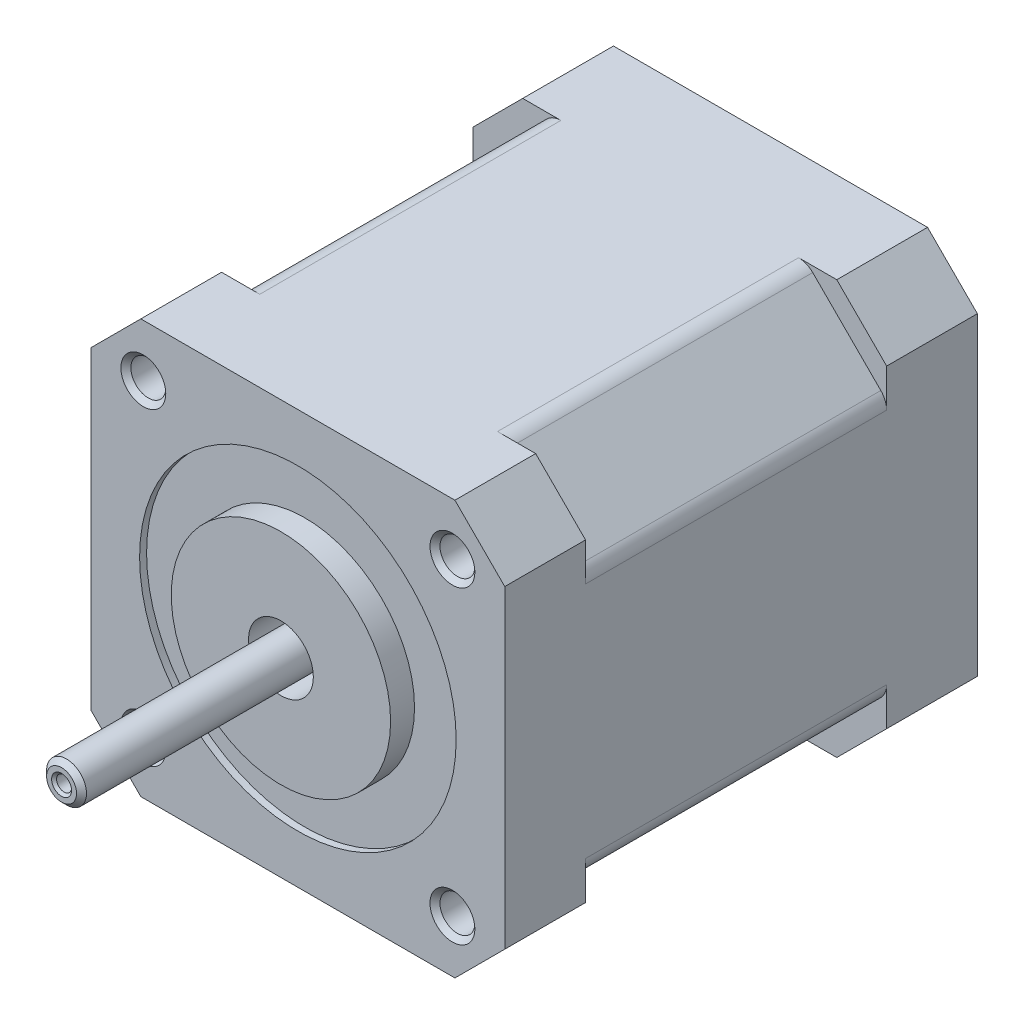
from build123d import *

# Parameters (mm, degrees)
BOSS_EXTRUDE1_DEPTH = 9.1
BOSS_EXTRUDE2_DEPTH = 30.2
BOSS_EXTRUDE3_DEPTH = 8.1
SKETCH4_R           = 15.875
CUT_EXTRUDE1_DEPTH  = 0.7
SKETCH5_R           = 11
BOSS_EXTRUDE4_DEPTH = 2.4
SKETCH6_R           = 1.75
CUT_EXTRUDE2_DEPTH  = 58.200830414
CHAMFER1_SIZE       = 0.5
SKETCH7_R           = 3.95
CUT_EXTRUDE3_DEPTH  = 3.3
SKETCH8_R           = 3.25
CUT_EXTRUDE4_DEPTH  = 5
SKETCH9_R           = 2
BOSS_EXTRUDE5_DEPTH = 27
CHAMFER2_SIZE       = 0.5
SKETCH10_R          = 0.75
CUT_EXTRUDE5_DEPTH  = 3
CHAMFER3_SIZE       = 0.25
SKETCH11_R          = 2.5
BOSS_EXTRUDE6_DEPTH = 0.5
CHAMFER4_SIZE       = 0.5
CUT_EXTRUDE6_START  = -3
SKETCH12_R          = 0.75
CUT_EXTRUDE6_DEPTH  = 3
CHAMFER5_SIZE       = 0.25
SKETCH14_W          = 8
SKETCH14_H          = 7.1
CUT_EXTRUDE8_DEPTH  = 5


with BuildPart() as part:
    # Sketch1 → Boss-Extrude1 (new body)
    with BuildSketch(Plane.XY):
        Polygon((15.75, 20.75), (20.75, 15.75), (20.75, -15.75), (15.75, -20.75), (-15.75, -20.75), (-20.75, -15.75), (-20.75, 15.75), (-15.75, 20.75), align=None)
    extrude(amount=BOSS_EXTRUDE1_DEPTH)

    # Sketch2 → Boss-Extrude2 (add)
    with BuildSketch(Plane.XY.offset(9.1)):
        with BuildLine():
            Line((13.335786438, 20.164213562), (20.164213562, 13.335786438))
            ThreePointArc((20.164213562, 13.335786438), (20.597759065, 12.68693974), (20.75, 11.921572875))
            Line((20.75, 11.921572875), (20.75, -11.921572875))
            ThreePointArc((20.75, -11.921572875), (20.597759065, -12.68693974), (20.164213562, -13.335786438))
            Line((20.164213562, -13.335786438), (13.335786438, -20.164213562))
            ThreePointArc((13.335786438, -20.164213562), (12.68693974, -20.597759065), (11.921572875, -20.75))
            Line((11.921572875, -20.75), (-11.921572875, -20.75))
            ThreePointArc((-11.921572875, -20.75), (-12.68693974, -20.597759065), (-13.335786438, -20.164213562))
            Line((-13.335786438, -20.164213562), (-20.164213562, -13.335786438))
            ThreePointArc((-20.164213562, -13.335786438), (-20.597759065, -12.68693974), (-20.75, -11.921572875))
            Line((-20.75, -11.921572875), (-20.75, 11.921572875))
            ThreePointArc((-20.75, 11.921572875), (-20.597759065, 12.68693974), (-20.164213562, 13.335786438))
            Line((-20.164213562, 13.335786438), (-13.335786438, 20.164213562))
            ThreePointArc((-13.335786438, 20.164213562), (-12.68693974, 20.597759065), (-11.921572875, 20.75))
            Line((-11.921572875, 20.75), (11.921572875, 20.75))
            ThreePointArc((11.921572875, 20.75), (12.68693974, 20.597759065), (13.335786438, 20.164213562))
        make_face()
    extrude(amount=BOSS_EXTRUDE2_DEPTH)

    # Sketch3 → Boss-Extrude3 (add)
    with BuildSketch(Plane.XY.offset(39.3)):
        Polygon((15.75, 20.75), (20.75, 15.75), (20.75, -15.75), (15.75, -20.75), (-15.75, -20.75), (-20.75, -15.75), (-20.75, 15.75), (-15.75, 20.75), align=None)
    extrude(amount=BOSS_EXTRUDE3_DEPTH)

    # Sketch4 → Cut-Extrude1 (cut)
    with BuildSketch(Plane.XY.offset(47.4)):
        Circle(SKETCH4_R)
    extrude(amount=-CUT_EXTRUDE1_DEPTH, mode=Mode.SUBTRACT)

    # Sketch5 → Boss-Extrude4 (add)
    with BuildSketch(Plane.XY.offset(46.7)):
        Circle(SKETCH5_R)
    extrude(amount=BOSS_EXTRUDE4_DEPTH)

    # Sketch6 → Cut-Extrude2 (cut, through all)
    with BuildSketch(Plane(origin=(0, 0, 0), x_dir=(-1, 0, 0), z_dir=(0, 0, -1))):
        with Locations((-15.5, 15.5)):
            Circle(SKETCH6_R)
        with Locations((-15.5, -15.5)):
            Circle(SKETCH6_R)
        with Locations((15.5, -15.5)):
            Circle(SKETCH6_R)
        with Locations((15.5, 15.5)):
            Circle(SKETCH6_R)
    extrude(amount=-CUT_EXTRUDE2_DEPTH, mode=Mode.SUBTRACT)

    # Chamfer1
    chamfer1_edges = [part.edges().sort_by_distance(p)[0] for p in [
        (17.25, 15.5, 47.4),
        (17.25, 15.5, 0),
        (17.25, -15.5, 47.4),
        (17.25, -15.5, 0),
        (-13.75, -15.5, 47.4),
        (-13.75, -15.5, 0),
        (-13.75, 15.5, 47.4),
        (-13.75, 15.5, 0),
    ]]
    chamfer(chamfer1_edges, length=CHAMFER1_SIZE)

    # Sketch7 → Cut-Extrude3 (cut)
    with BuildSketch(Plane(origin=(0, 0, 0), x_dir=(-1, 0, 0), z_dir=(0, 0, -1))):
        Circle(SKETCH7_R)
    extrude(amount=-CUT_EXTRUDE3_DEPTH, mode=Mode.SUBTRACT)

    # Sketch8 → Cut-Extrude4 (cut)
    with BuildSketch(Plane.XY.offset(49.1)):
        Circle(SKETCH8_R)
    extrude(amount=-CUT_EXTRUDE4_DEPTH, mode=Mode.SUBTRACT)

    # Sketch9 → Boss-Extrude5 (add)
    with BuildSketch(Plane.XY.offset(44.1)):
        Circle(SKETCH9_R)
    extrude(amount=BOSS_EXTRUDE5_DEPTH)

    # Chamfer2
    chamfer2_edges = [part.edges().sort_by_distance(p)[0] for p in [
        (-2, 0, 71.1),
    ]]
    chamfer(chamfer2_edges, length=CHAMFER2_SIZE)

    # Sketch10 → Cut-Extrude5 (cut)
    with BuildSketch(Plane.XY.offset(71.1)):
        Circle(SKETCH10_R)
    extrude(amount=-CUT_EXTRUDE5_DEPTH, mode=Mode.SUBTRACT)

    # Chamfer3
    chamfer3_edges = [part.edges().sort_by_distance(p)[0] for p in [
        (-0.75, 0, 71.1),
    ]]
    chamfer(chamfer3_edges, length=CHAMFER3_SIZE)

    # Sketch11 → Boss-Extrude6 (add)
    with BuildSketch(Plane(origin=(0, 0, 3.3), x_dir=(-1, 0, 0), z_dir=(0, 0, -1))):
        Circle(SKETCH11_R)
    extrude(amount=BOSS_EXTRUDE6_DEPTH)

    # Chamfer4
    chamfer4_edges = [part.edges().sort_by_distance(p)[0] for p in [
        (2.5, 0, 2.8),
    ]]
    chamfer(chamfer4_edges, length=CHAMFER4_SIZE - 0.0001)  # a hair under: the kernel refuses the full size

    # Sketch12 → Cut-Extrude6 (cut)
    with BuildSketch(Plane(origin=(0, 0, 2.8), x_dir=(-1, 0, 0), z_dir=(0, 0, -1)).offset(CUT_EXTRUDE6_START)):
        with Locations(Location((0, 0, 0), (0, 0, 180))):
            Circle(SKETCH12_R)
    extrude(amount=CUT_EXTRUDE6_DEPTH, mode=Mode.SUBTRACT)

    # Chamfer5
    chamfer5_edges = [part.edges().sort_by_distance(p)[0] for p in [
        (-0.75, 0, 2.8),
    ]]
    chamfer(chamfer5_edges, length=CHAMFER5_SIZE)

    # Sketch14 → Cut-Extrude8 (cut)
    with BuildSketch(Plane.XZ.offset(20.75)):
        with Locations((0, 4.55)):
            Rectangle(SKETCH14_W, SKETCH14_H)
    extrude(amount=-CUT_EXTRUDE8_DEPTH, mode=Mode.SUBTRACT)


solid = part.part
